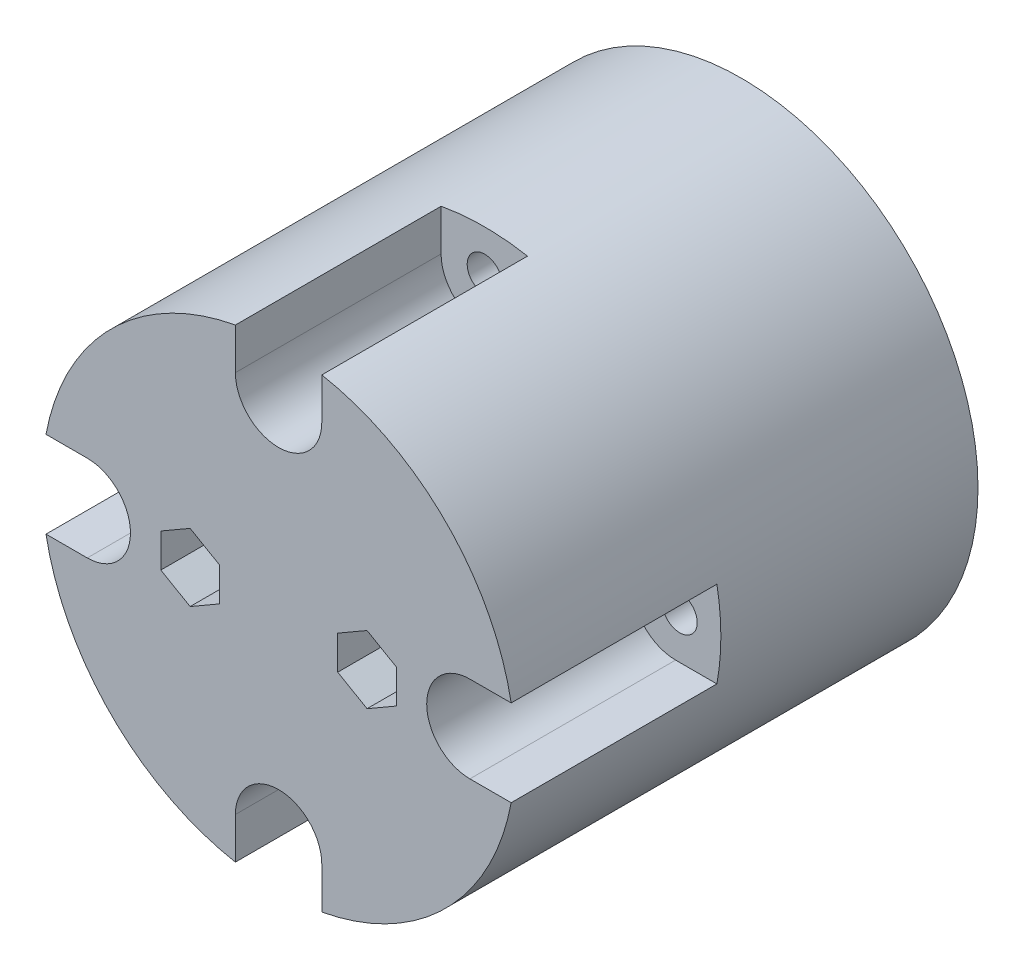
from build123d import *

# Parameters (mm, degrees)
BOSS_EXTRUDE1_OUTLINE_R    = 16
BOSS_EXTRUDE1_DEPTH        = 15
SKETCH2_W                  = 7.4
SKETCH2_H                  = 24.742483552
CUT_EXTRUDE1_DEPTH         = 16.8
SKETCH3_R                  = 1.71
CUT_EXTRUDE2_DEPTH         = 70
BOSS_EXTRUDE2_DEPTH        = 20
BOSS_EXTRUDE2_DEPTH_BACK   = 5
SKETCH10_R                 = 23
SKETCH10_R_2               = 1.7
CUT_EXTRUDE4_DEPTH         = 25
SKETCH3_11_R               = 1.71
CUT_EXTRUDE5_DEPTH         = 55
CUT_EXTRUDE6_DEPTH         = 2.3
CUT_EXTRUDE6_DEPTH_BACK    = 0.7
SKETCH14_R                 = 12.3
BOSS_EXTRUDE3_START        = 20
BOSS_EXTRUDE3_DEPTH        = 20
SKETCH19_R                 = 16.2
CUT_EXTRUDE7_DEPTH         = 2.2
CUT_EXTRUDE8_START         = 35
CUT_EXTRUDE8_OUTLINE_R     = 1.7
CUT_EXTRUDE8_DEPTH         = 20
CUT_EXTRUDE9_START         = 2
CUT_EXTRUDE9_OUTLINE_R     = 16
CUT_EXTRUDE9_OUTLINE_R_2   = 15.484452344
CUT_EXTRUDE9_DEPTH         = 8
CUT_EXTRUDE9_START_2       = 10
CUT_EXTRUDE9_2_OUTLINE_R   = 3.25
CUT_EXTRUDE9_2_OUTLINE_R_2 = 1.7
CUT_EXTRUDE9_2_DEPTH       = 3
CUT_EXTRUDE10_DEPTH        = 3.6
SKETCH36_R                 = 15.484452344
CUT_EXTRUDE11_DEPTH        = 8
CUT_EXTRUDE13_DEPTH        = 5
CUT_EXTRUDE14_DEPTH        = 10
SKETCH39_R                 = 3.25
CUT_EXTRUDE15_DEPTH        = 5


# Read off the part's stored shape, not the designer's step: Boss-Extrude1, Cut-Extrude8, Cut-Extrude9
with BuildPart() as part:
    # Boss-Extrude1 outline → Boss-Extrude1 (new body)
    with BuildSketch(Plane(origin=(0, 0, 0), x_dir=(0, 1, 0), z_dir=(0, 0, 1))):
        Circle(BOSS_EXTRUDE1_OUTLINE_R)
    extrude(amount=BOSS_EXTRUDE1_DEPTH)

    # Sketch2 → Cut-Extrude1 (cut)
    with BuildSketch(Plane.ZY.offset(16)):
        with Locations((10.1, 0)):
            Rectangle(SKETCH2_W, SKETCH2_H)
    extrude(amount=-CUT_EXTRUDE1_DEPTH, mode=Mode.SUBTRACT)

    # Sketch3 → Cut-Extrude2 (cut)
    with BuildSketch(Plane(origin=(0, 0, 0), x_dir=(0, 1, 0), z_dir=(0, 0, 1))):
        with Locations((0, 8.6)):
            Circle(SKETCH3_R)
    extrude(amount=CUT_EXTRUDE2_DEPTH, mode=Mode.SUBTRACT)

    # Sketch10 → Boss-Extrude2 (add, two sides: drawn at the far end of the back side and taken through both)
    with BuildSketch(Plane(origin=(0, 0, 15), x_dir=(0, 1, 0), z_dir=(0, 0, 1)).offset(-BOSS_EXTRUDE2_DEPTH_BACK)):
        with Locations(Location((0, 0, 0), (0, 0, 270))):
            Circle(SKETCH10_R)
        with Locations(Location((0, 8.6, 0), (0, 0, 270))):
            Circle(SKETCH10_R_2, mode=Mode.SUBTRACT)
        with Locations(Location((0, 19, 0), (0, 0, 270))):
            Circle(SKETCH10_R_2, mode=Mode.SUBTRACT)
        with Locations(Location((18.999966339, -0.035764812, 0), (0, 0, 90))):
            Circle(SKETCH10_R_2, mode=Mode.SUBTRACT)
        with Locations(Location((0, -19, 0), (0, 0, 90))):
            Circle(SKETCH10_R_2, mode=Mode.SUBTRACT)
        with Locations(Location((-18.999966339, -0.035764812, 0), (0, 0, 270))):
            Circle(SKETCH10_R_2, mode=Mode.SUBTRACT)
        with Locations(Location((0, -8.6, 0), (0, 0, 270))):
            Circle(SKETCH10_R_2, mode=Mode.SUBTRACT)
    extrude(amount=BOSS_EXTRUDE2_DEPTH + BOSS_EXTRUDE2_DEPTH_BACK)

    # Sketch3<6> → Cut-Extrude4 (cut)
    with BuildSketch(Plane(origin=(0, 0, 0), x_dir=(0, 1, 0), z_dir=(0, 0, 1))):
        with BuildLine():
            Line((3, -2.939387691), (-3, -2.939387691))
            ThreePointArc((-3, -2.939387691), (0, 4.2), (3, -2.939387691))
        make_face()
    extrude(amount=CUT_EXTRUDE4_DEPTH, mode=Mode.SUBTRACT)

    # Sketch3<11> → Cut-Extrude5 (cut)
    with BuildSketch(Plane(origin=(0, 0, 0), x_dir=(0, 1, 0), z_dir=(0, 0, 1))):
        with Locations(Location((0, -8.6, 0), (0, 0, 90))):
            Circle(SKETCH3_11_R)
    extrude(amount=CUT_EXTRUDE5_DEPTH, mode=Mode.SUBTRACT)

    # Sketch14 → Cut-Extrude6 (cut, two sides: drawn at the far end of the back side and taken through both)
    with BuildSketch(Plane(origin=(0, 0, 7.5), x_dir=(0, 1, 0), z_dir=(0, 0, 1)).offset(-CUT_EXTRUDE6_DEPTH_BACK)):
        Circle(SKETCH14_R)
    extrude(amount=CUT_EXTRUDE6_DEPTH + CUT_EXTRUDE6_DEPTH_BACK, mode=Mode.SUBTRACT)

    # Sketch15 → Boss-Extrude3 (add)
    with BuildSketch(Plane(origin=(0, 0, 35), x_dir=(0, 1, 0), z_dir=(0, 0, 1)).offset(BOSS_EXTRUDE3_START)):
        with BuildLine():
            Line((-4.2, 18.6), (-4.2, 22.61327044))
            ThreePointArc((-4.2, 22.61327044), (-16.263455967, 16.263455967), (-22.61327044, 4.2))
            Line((-22.61327044, 4.2), (-18.6, 4.2))
            ThreePointArc((-18.6, 4.2), (-14.4, 0), (-18.6, -4.2))
            Line((-18.6, -4.2), (-22.61327044, -4.2))
            ThreePointArc((-22.61327044, -4.2), (-16.263455967, -16.263455967), (-4.2, -22.61327044))
            Line((-4.2, -22.61327044), (-4.2, -18.6))
            ThreePointArc((-4.2, -18.6), (0, -14.4), (4.2, -18.6))
            Line((4.2, -18.6), (4.2, -22.61327044))
            ThreePointArc((4.2, -22.61327044), (16.263455967, -16.263455967), (22.61327044, -4.2))
            Line((22.61327044, -4.2), (18.6, -4.2))
            ThreePointArc((18.6, -4.2), (14.4, 0), (18.6, 4.2))
            Line((18.6, 4.2), (22.61327044, 4.2))
            ThreePointArc((22.61327044, 4.2), (16.263455967, 16.263455967), (4.2, 22.61327044))
            Line((4.2, 22.61327044), (4.2, 18.6))
            ThreePointArc((4.2, 18.6), (0, 14.4), (-4.2, 18.6))
        make_face()
    extrude(amount=-BOSS_EXTRUDE3_DEPTH)

    # Sketch19 → Cut-Extrude7 (cut)
    with BuildSketch(Plane.YX.offset(0.2)):
        Circle(SKETCH19_R)
    extrude(amount=-CUT_EXTRUDE7_DEPTH, mode=Mode.SUBTRACT)

    # Cut-Extrude8 outline → Cut-Extrude8 (cut)
    with BuildSketch(Plane.XY.offset(CUT_EXTRUDE8_START)):
        with Locations((-8.6, 0)):
            Circle(CUT_EXTRUDE8_OUTLINE_R)
        with Locations((8.6, 0)):
            Circle(CUT_EXTRUDE8_OUTLINE_R)
    extrude(amount=CUT_EXTRUDE8_DEPTH, mode=Mode.SUBTRACT)

    # Sketch24 → CBORE for M3 SHCS1 (revolve, cut)
    with BuildSketch(Plane(origin=(0.035764812, 18.999966339, 10), x_dir=(0, 1, 0), z_dir=(1, 0, 0))):
        Polygon((0, 0), (0, 45), (1.7, 45), (1.7, 3), (3.25, 3), (3.25, 0), align=None)
    revolve(axis=Axis((0.035764812, 18.999966339, 3.65), (0, 0, 1)), mode=Mode.SUBTRACT)

    # Cut-Extrude9 outline → Cut-Extrude9 (cut)
    with BuildSketch(Plane.XY.offset(CUT_EXTRUDE9_START)):
        Circle(CUT_EXTRUDE9_OUTLINE_R)
        Circle(CUT_EXTRUDE9_OUTLINE_R_2, mode=Mode.SUBTRACT)
    extrude(amount=CUT_EXTRUDE9_DEPTH, mode=Mode.SUBTRACT)

    # Cut-Extrude9 2 outline → Cut-Extrude9 2 (cut)
    # profile 1 of 3: a face of its own
    with BuildSketch(Plane.XY.offset(CUT_EXTRUDE9_START_2)):
        with Locations((-19, 0)):
            Circle(CUT_EXTRUDE9_2_OUTLINE_R)
        with Locations((-19, 0)):
            Circle(CUT_EXTRUDE9_2_OUTLINE_R_2, mode=Mode.SUBTRACT)
    # profile 2 of 3: a face of its own
    with BuildSketch(Plane.XY.offset(CUT_EXTRUDE9_START_2)):
        with Locations((19, 0)):
            Circle(CUT_EXTRUDE9_2_OUTLINE_R)
        with Locations((19, 0)):
            Circle(CUT_EXTRUDE9_2_OUTLINE_R_2, mode=Mode.SUBTRACT)
    # profile 3 of 3: a face of its own
    with BuildSketch(Plane.XY.offset(CUT_EXTRUDE9_START_2)):
        with Locations((0.035764812, -18.999966339)):
            Circle(CUT_EXTRUDE9_2_OUTLINE_R)
        with Locations((0.035764812, -18.999966339)):
            Circle(CUT_EXTRUDE9_2_OUTLINE_R_2, mode=Mode.SUBTRACT)
    extrude(amount=CUT_EXTRUDE9_2_DEPTH, mode=Mode.SUBTRACT)

    # Sketch31 → Cut-Extrude10 (cut)
    with BuildSketch(Plane(origin=(0, 0, 10), x_dir=(0, 1, 0), z_dir=(0, 0, 1))):
        with BuildLine():
            Line((-12.4, 0), (12.4, 0))
            ThreePointArc((12.4, 0), (0, -12.4), (-12.4, 0))
        make_face()
    extrude(amount=-CUT_EXTRUDE10_DEPTH, mode=Mode.SUBTRACT)

    # Sketch36 → Cut-Extrude11 (cut)
    with BuildSketch(Plane(origin=(0, 0, 2), x_dir=(0, 1, 0), z_dir=(0, 0, 1))):
        Circle(SKETCH36_R)
    extrude(amount=CUT_EXTRUDE11_DEPTH, mode=Mode.SUBTRACT)

    # Sketch37 → Cut-Extrude13 (cut)
    with BuildSketch(Plane(origin=(0, 0, 15), x_dir=(0, 1, 0), z_dir=(0, 0, 1))):
        with BuildLine():
            Line((6.408587988, -13.1), (13.971876514, 0))
            Line((13.971876514, 0), (6.408587988, 13.1))
            Line((6.408587988, 13.1), (-11.971876514, 13.1))
            ThreePointArc((-11.971876514, 13.1), (-13.386090077, 12.514213562), (-13.971876514, 11.1))
            Line((-13.971876514, 11.1), (-13.971876514, -11.1))
            ThreePointArc((-13.971876514, -11.1), (-13.386090077, -12.514213562), (-11.971876514, -13.1))
            Line((-11.971876514, -13.1), (6.408587988, -13.1))
        make_face()
    extrude(amount=-CUT_EXTRUDE13_DEPTH, mode=Mode.SUBTRACT)

    # Sketch38 → Cut-Extrude14 (cut)
    with BuildSketch(Plane(origin=(0, 0, 55), x_dir=(0, 1, 0), z_dir=(0, 0, 1))):
        Polygon((3.290896534, 8.6), (1.645448267, 11.45), (-1.645448267, 11.45), (-3.290896534, 8.6), (-1.645448267, 5.75), (1.645448267, 5.75), align=None)
        Polygon((3.290896534, -8.6), (1.645448267, -5.75), (-1.645448267, -5.75), (-3.290896534, -8.6), (-1.645448267, -11.45), (1.645448267, -11.45), align=None)
    extrude(amount=-CUT_EXTRUDE14_DEPTH, mode=Mode.SUBTRACT)

    # Sketch39 → Cut-Extrude15 (cut)
    with BuildSketch(Plane(origin=(0, 0, 10), x_dir=(0, 1, 0), z_dir=(0, 0, 1))):
        with Locations(Location((0, 19, 0), (0, 0, 90))):
            Circle(SKETCH39_R)
        with Locations(Location((-18.999966339, -0.035764812, 0), (0, 0, 90))):
            Circle(SKETCH39_R)
        with Locations(Location((0, -19, 0), (0, 0, 90))):
            Circle(SKETCH39_R)
        with Locations(Location((18.999966339, -0.035764812, 0), (0, 0, 90))):
            Circle(SKETCH39_R)
    extrude(amount=CUT_EXTRUDE15_DEPTH, mode=Mode.SUBTRACT)


solid = part.part
